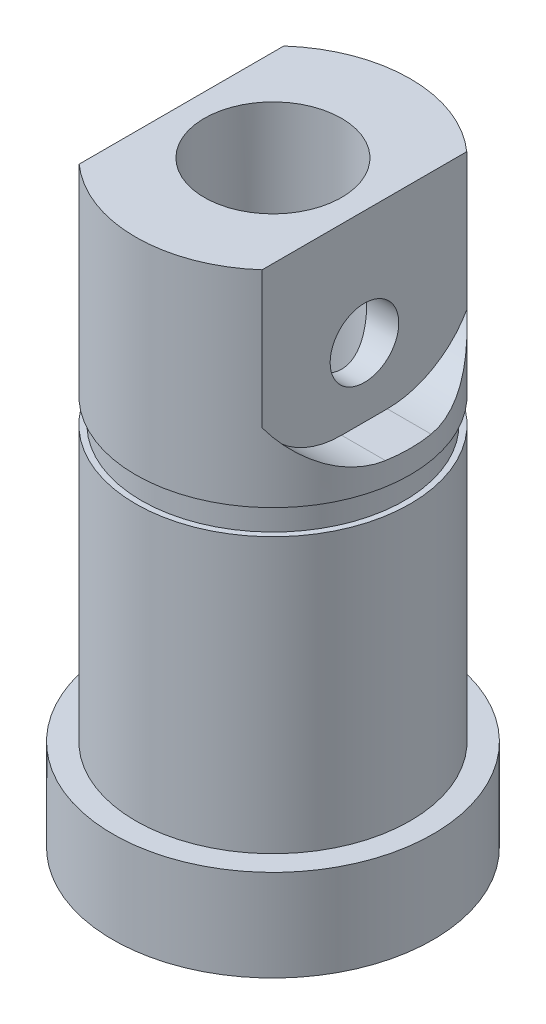
from build123d import *

# Parameters (mm, degrees)
CUT_EXTRUDE2_DEPTH = 2
SKETCH4_R          = 1.5
CUT_EXTRUDE3_DEPTH = 30.175503513


with BuildPart() as part:
    # Sketch2 → Revolve1 (revolve)
    with BuildSketch(Plane.XY):
        Polygon((-3, 26.1), (-6, 26.1), (-6, 17.1), (-5.75, 17.1), (-5.75, 16), (-6, 16), (-6, 4), (-7, 4), (-7, 0), (-5, 0), (-5, 1.8), (-3, 1.8), align=None)
    revolve(axis=Axis((0, 0, 0), (0, 1, 0)))

    # Sketch3 → Cut-Extrude2 (cut)
    with BuildSketch(Plane.ZY.offset(6)):
        with BuildLine():
            Line((9, 26.1), (-9, 26.1))
            ThreePointArc((-9, 26.1), (-6.171572875, 24.928427125), (-5, 22.1))
            ThreePointArc((-5, 22.1), (-3.828427125, 19.271572875), (-1, 18.1))
            Line((-1, 18.1), (1, 18.1))
            ThreePointArc((1, 18.1), (3.828427125, 19.271572875), (5, 22.1))
            ThreePointArc((5, 22.1), (6.171572875, 24.928427125), (9, 26.1))
        make_face()
    cut_extrude2 = extrude(amount=-CUT_EXTRUDE2_DEPTH, mode=Mode.SUBTRACT)

    # Mirror1: Cut-Extrude2 across plane
    add(cut_extrude2.mirror(Plane(origin=(0, 0, 0), x_dir=(0, 0, 1), z_dir=(1, 0, 0))), mode=Mode.SUBTRACT)

    # Sketch4 → Cut-Extrude3 (cut, through all)
    with BuildSketch(Plane.ZY.offset(4)):
        with Locations((0, 21.1)):
            Circle(SKETCH4_R)
    extrude(amount=-CUT_EXTRUDE3_DEPTH, mode=Mode.SUBTRACT)


solid = part.part
